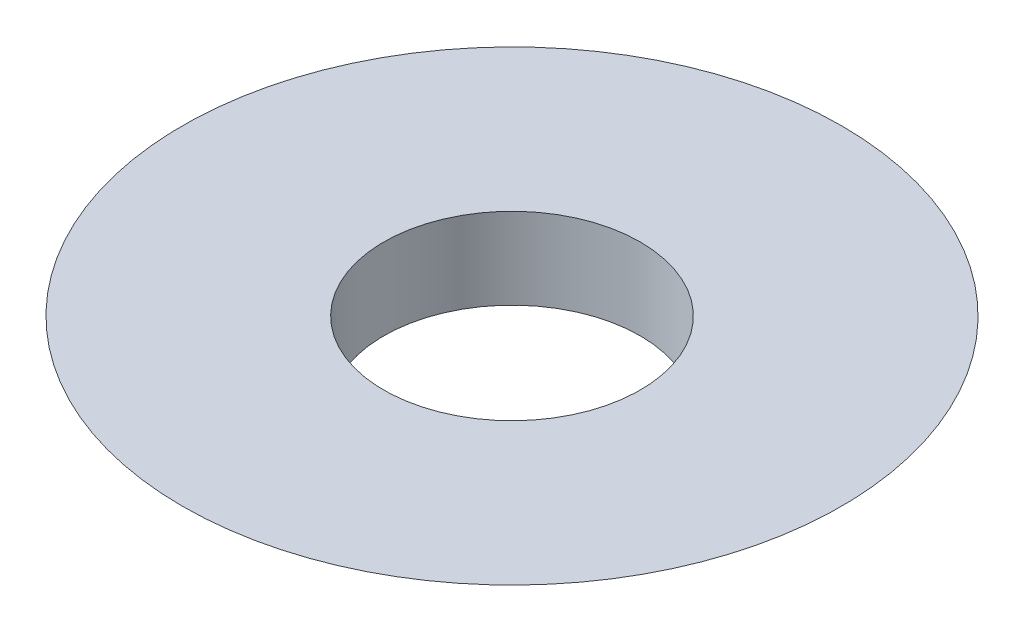
from build123d import *


with BuildPart() as part:
    # Sketch1 → Revolve1 (revolve)
    with BuildSketch(Plane.XY):
        Polygon((16.51, 0), (42.415516897, 10.46650822), (16.51, 10.46650822), align=None)
    revolve(axis=Axis((0, 0, 0), (0, 1, 0)))


solid = part.part
